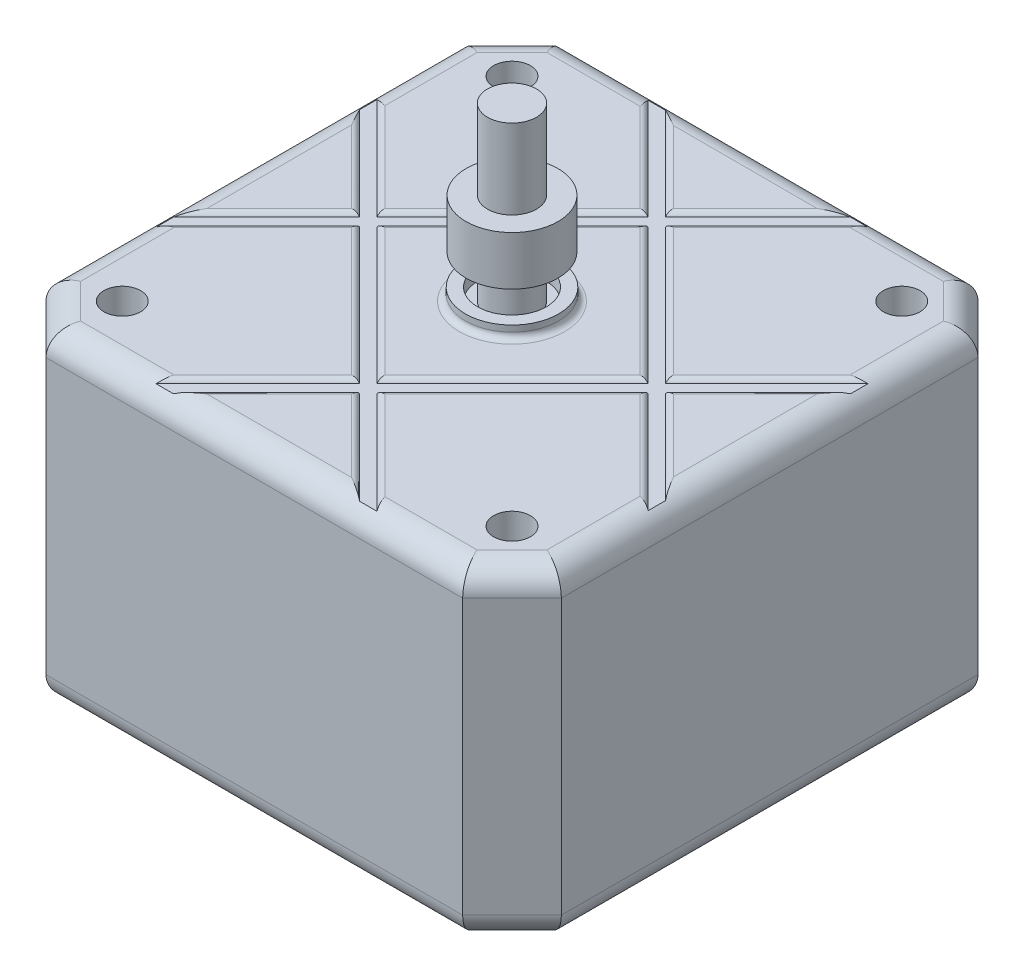
from build123d import *

# Parameters (mm, degrees)
SKETCH1_R                = 2
BOSS_EXTRUDE1_DEPTH      = 26.4
BOSS_EXTRUDE2_DEPTH      = 1
BOSS_EXTRUDE2_DEPTH_BACK = 27.4
SKETCH2_R                = 3.8
SKETCH2_R_2              = 2.8
FILLET1_R                = 2
FILLET3_R                = 2
BOSS_EXTRUDE3_DEPTH      = 14
BOSS_EXTRUDE3_DEPTH_BACK = 28
SKETCH3_R                = 2
CUT_EXTRUDE1_DEPTH       = 0.3
FILLET4_START            = -24.886359534
FILLET4_2_DEPTH          = 49.772719068
FILLET4_START_2          = -24.853755836
FILLET4_3_DEPTH          = 49.707511672
CUT_EXTRUDE2_DEPTH       = 26.4
SKETCH7_R                = 3.75
BOSS_EXTRUDE4_DEPTH      = 4


with BuildPart() as part:
    # Sketch1 → Boss-Extrude1 (new body)
    with BuildSketch(Plane(origin=(0, 0, 0), x_dir=(1, 0, 0), z_dir=(0, 1, 0))):
        Polygon((-16.976945704, 21), (17.023054296, 21), (21, 17.023054296), (21, -16.976945704), (16.976945704, -21), (-17.023054296, -21), (-21, -17.023054296), (-21, 16.976945704), align=None)
        with Locations(Location((0, 0, 0), (0, 0, 270))):
            Circle(SKETCH1_R, mode=Mode.SUBTRACT)
    extrude(amount=BOSS_EXTRUDE1_DEPTH)

    # Sketch2 → Boss-Extrude2 (add, two sides: drawn at the far end of the back side and taken through both)
    with BuildSketch(Plane(origin=(0, 26.4, 0), x_dir=(1, 0, 0), z_dir=(0, 1, 0)).offset(-BOSS_EXTRUDE2_DEPTH_BACK)):
        with Locations(Location((0, 0, 0), (0, 0, 270))):
            Circle(SKETCH2_R)
        with Locations(Location((0, 0, 0), (0, 0, 270))):
            Circle(SKETCH2_R_2, mode=Mode.SUBTRACT)
    extrude(amount=BOSS_EXTRUDE2_DEPTH + BOSS_EXTRUDE2_DEPTH_BACK)

    # Fillet1
    fillet1_edges = [part.edges().sort_by_distance(p)[0] for p in [
        (-0.023054296, 0, 21),
        (-19.011527148, 0, 19.011527148),
        (-21, 0, 0.023054296),
        (-18.988472852, 0, -18.988472852),
        (0.023054296, 0, -21),
        (19.011527148, 0, -19.011527148),
        (21, 0, -0.023054296),
        (18.988472852, 0, 18.988472852),
    ]]
    fillet(fillet1_edges, radius=FILLET1_R)

    # Fillet3
    fillet3_edges = [part.edges().sort_by_distance(p)[0] for p in [
        (-19.011527148, 26.4, 19.011527148),
        (-0.023054296, 26.4, 21),
        (18.988472852, 26.4, 18.988472852),
        (21, 26.4, -0.023054296),
        (19.011527148, 26.4, -19.011527148),
        (0.023054296, 26.4, -21),
        (-18.988472852, 26.4, -18.988472852),
        (-21, 26.4, 0.023054296),
    ]]
    fillet(fillet3_edges, radius=FILLET3_R)

    # Sketch3 → Boss-Extrude3 (add, two sides: drawn at the far end of the back side and taken through both)
    with BuildSketch(Plane(origin=(0, 26.4, 0), x_dir=(1, 0, 0), z_dir=(0, 1, 0)).offset(-BOSS_EXTRUDE3_DEPTH_BACK)):
        with Locations(Location((0, 0, 0), (0, 0, 270))):
            Circle(SKETCH3_R)
    extrude(amount=BOSS_EXTRUDE3_DEPTH + BOSS_EXTRUDE3_DEPTH_BACK)

    # Sketch5 → Cut-Extrude1 (cut)
    with BuildSketch(Plane(origin=(0, 26.4, 0), x_dir=(1, 0, 0), z_dir=(0, 1, 0))):
        Polygon((-12.453891408, 0.023054296), (-11.746784627, 0.730161077), (-19, 7.98337645), (-19, 6.569162888), align=None)
        Polygon((-19, 6.569162888), (-19, 7.98337645), (-19.583168494, 8.566544944), (-21, 9.98337645), (-21, 8.569162888), align=None)
        Polygon((-6.476945704, 19), (-8.476945704, 21), (-9.891159266, 21), (-8.479553991, 19.588394725), (-7.891159266, 19), align=None)
        Polygon((0.023054296, 12.5), (-6.476945704, 19), (-7.891159266, 19), (-0.684052485, 11.792893219), align=None)
        Polygon((7.937267858, 19), (6.523054296, 19), (0.023054296, 12.5), (0.730161077, 11.792893219), align=None)
        Polygon((9.937267858, 21), (8.523054296, 21), (6.523054296, 19), (7.937267858, 19), (8.523054296, 19.585786438), align=None)
        Polygon((0.730161077, 11.792893219), (0.023054296, 12.5), (-0.684052485, 11.792893219), (0.023054296, 11.085786438), align=None)
        Polygon((0.023054296, 11.085786438), (-0.684052485, 11.792893219), (-11.746784627, 0.730161077), (-11.039677846, 0.023054296), align=None)
        Polygon((11.792893219, 0.730161077), (0.730161077, 11.792893219), (0.023054296, 11.085786438), (11.085786438, 0.023054296), align=None)
        Polygon((19.585786438, 8.523054296), (19, 7.937267858), (19, 6.523054296), (21, 8.523054296), (21, 9.937267858), align=None)
        Polygon((19, 7.937267858), (11.792893219, 0.730161077), (12.5, 0.023054296), (19, 6.523054296), align=None)
        Polygon((12.5, 0.023054296), (11.792893219, 0.730161077), (11.085786438, 0.023054296), (11.792893219, -0.684052485), align=None)
        Polygon((19, -6.476945704), (12.5, 0.023054296), (11.792893219, -0.684052485), (19, -7.891159266), align=None)
        Polygon((11.792893219, -0.684052485), (11.085786438, 0.023054296), (0.023054296, -11.039677846), (0.730161077, -11.746784627), align=None)
        Polygon((21, -8.476945704), (19, -6.476945704), (19, -7.891159266), (19.585786438, -8.476945704), (21, -9.891159266), align=None)
        Polygon((7.98337645, -19), (0.730161077, -11.746784627), (0.023054296, -12.453891408), (6.569162888, -19), align=None)
        Polygon((8.523054296, -19.539677846), (7.98337645, -19), (6.569162888, -19), (8.523054296, -20.953891408), (8.569162888, -21), (9.98337645, -21), align=None)
        Polygon((0.023054296, -12.453891408), (-0.684052485, -11.746784627), (-7.937267858, -19), (-6.523054296, -19), align=None)
        Polygon((0.730161077, -11.746784627), (0.023054296, -11.039677846), (-0.684052485, -11.746784627), (0.023054296, -12.453891408), align=None)
        Polygon((0.023054296, -11.039677846), (-11.039677846, 0.023054296), (-11.746784627, -0.684052485), (-0.684052485, -11.746784627), align=None)
        Polygon((-6.523054296, -19), (-7.937267858, -19), (-8.523054296, -19.585786438), (-9.937267858, -21), (-8.523054296, -21), align=None)
        Polygon((-19, -7.937267858), (-19, -6.523054296), (-21, -8.523054296), (-21, -9.937267858), (-19.585786438, -8.523054296), align=None)
        Polygon((-11.746784627, -0.684052485), (-12.453891408, 0.023054296), (-19, -6.523054296), (-19, -7.937267858), align=None)
        Polygon((-11.039677846, 0.023054296), (-11.746784627, 0.730161077), (-12.453891408, 0.023054296), (-11.746784627, -0.684052485), align=None)
    extrude(amount=-CUT_EXTRUDE1_DEPTH, mode=Mode.SUBTRACT)

    # Fillet4: read off the stored shape, not the designer's step
    # Fillet4 outline → Fillet4 (revolve)
    with BuildSketch(Plane.XY):
        with BuildLine():
            ThreePointArc((4.3, 26.4), (3.946446609, 26.546446609), (3.8, 26.9))
            Line((3.8, 26.9), (3.8, 26.4))
            Line((3.8, 26.4), (4.3, 26.4))
        make_face()
    revolve(axis=Axis((0, 0, 0), (0, 1, 0)))

    # Fillet4 2 outline → Fillet4 2 (cut)
    with BuildSketch(Plane(origin=(0, 0, 0), x_dir=(0.7071067811865471, 0, 0.707106781186548), z_dir=(0.707106781186548, 0, -0.707106781186547)).offset(FILLET4_START)):
        with BuildLine():
            Line((8.822532916, -26.4), (9.280790485, -26.4))
            ThreePointArc((9.280790485, -26.4), (9.006929207, -26.318330013), (8.822532916, -26.1))
            Line((8.822532916, -26.1), (8.822532916, -26.4))
        make_face()
        with BuildLine():
            ThreePointArc((-8.822532916, -26.1), (-9.006929207, -26.318330013), (-9.280790485, -26.4))
            Line((-9.280790485, -26.4), (-8.822532916, -26.4))
            Line((-8.822532916, -26.4), (-8.822532916, -26.1))
        make_face()
        with BuildLine():
            ThreePointArc((7.822532916, -26.1), (7.638136625, -26.318330013), (7.364275346, -26.4))
            Line((7.364275346, -26.4), (7.822532916, -26.4))
            Line((7.822532916, -26.4), (7.822532916, -26.1))
        make_face()
        with BuildLine():
            ThreePointArc((-7.364275346, -26.4), (-7.638136625, -26.318330013), (-7.822532916, -26.1))
            Line((-7.822532916, -26.1), (-7.822532916, -26.4))
            Line((-7.822532916, -26.4), (-7.364275346, -26.4))
        make_face()
    extrude(amount=FILLET4_2_DEPTH, mode=Mode.SUBTRACT)

    # Fillet4 3 outline → Fillet4 3 (cut)
    with BuildSketch(Plane(origin=(0, 0, 0), x_dir=(0.7071067811865471, 0, -0.707106781186548), z_dir=(0.707106781186548, 0, 0.707106781186547)).offset(FILLET4_START_2)):
        with BuildLine():
            Line((8.855136614, 26.4), (8.855136614, 26.1))
            ThreePointArc((8.855136614, 26.1), (9.039532905, 26.318330013), (9.313394183, 26.4))
            Line((9.313394183, 26.4), (8.855136614, 26.4))
        make_face()
        with BuildLine():
            ThreePointArc((-9.248186787, 26.4), (-8.974325509, 26.318330013), (-8.789929218, 26.1))
            Line((-8.789929218, 26.1), (-8.789929218, 26.4))
            Line((-8.789929218, 26.4), (-9.248186787, 26.4))
        make_face()
        with BuildLine():
            Line((7.855136614, 26.4), (7.396879044, 26.4))
            ThreePointArc((7.396879044, 26.4), (7.670740323, 26.318330013), (7.855136614, 26.1))
            Line((7.855136614, 26.1), (7.855136614, 26.4))
        make_face()
        with BuildLine():
            ThreePointArc((-7.789929218, 26.1), (-7.605532927, 26.318330013), (-7.331671648, 26.4))
            Line((-7.331671648, 26.4), (-7.789929218, 26.4))
            Line((-7.789929218, 26.4), (-7.789929218, 26.1))
        make_face()
    extrude(amount=FILLET4_3_DEPTH, mode=Mode.SUBTRACT)

    # Sketch6 → Cut-Extrude2 (cut)
    with BuildSketch(Plane.XZ):
        with BuildLine():
            Line((-15.9, 14.4), (-15.9, 15.9))
            Line((-15.9, 15.9), (-14.4, 15.9))
            ThreePointArc((-14.4, 15.9), (-16.960660172, 16.960660172), (-15.9, 14.4))
        make_face()
        with BuildLine():
            Line((-14.4, 15.9), (-15.9, 15.9))
            Line((-15.9, 15.9), (-15.9, 14.4))
            ThreePointArc((-15.9, 14.4), (-14.839339828, 14.839339828), (-14.4, 15.9))
        make_face()
        with BuildLine():
            ThreePointArc((17.4, 15.9), (15.9, 17.4), (14.4, 15.9))
            Line((14.4, 15.9), (15.9, 15.9))
            Line((15.9, 15.9), (15.9, 14.4))
            ThreePointArc((15.9, 14.4), (16.960660172, 14.839339828), (17.4, 15.9))
        make_face()
        with BuildLine():
            Line((15.9, 15.9), (14.4, 15.9))
            ThreePointArc((14.4, 15.9), (14.839339828, 14.839339828), (15.9, 14.4))
            Line((15.9, 14.4), (15.9, 15.9))
        make_face()
        with BuildLine():
            ThreePointArc((17.4, -15.9), (16.960660172, -14.839339828), (15.9, -14.4))
            Line((15.9, -14.4), (15.9, -15.9))
            Line((15.9, -15.9), (14.4, -15.9))
            ThreePointArc((14.4, -15.9), (15.9, -17.4), (17.4, -15.9))
        make_face()
        with BuildLine():
            Line((15.9, -15.9), (15.9, -14.4))
            ThreePointArc((15.9, -14.4), (14.839339828, -14.839339828), (14.4, -15.9))
            Line((14.4, -15.9), (15.9, -15.9))
        make_face()
        with BuildLine():
            ThreePointArc((-14.4, -15.9), (-14.839339828, -14.839339828), (-15.9, -14.4))
            Line((-15.9, -14.4), (-15.9, -15.9))
            Line((-15.9, -15.9), (-14.4, -15.9))
        make_face()
        with BuildLine():
            Line((-15.9, -15.9), (-15.9, -14.4))
            ThreePointArc((-15.9, -14.4), (-16.960660172, -16.960660172), (-14.4, -15.9))
            Line((-14.4, -15.9), (-15.9, -15.9))
        make_face()
    extrude(amount=-CUT_EXTRUDE2_DEPTH, mode=Mode.SUBTRACT)

    # Sketch7 → Boss-Extrude4 (add)
    with BuildSketch(Plane(origin=(0, 33.9, 0), x_dir=(1, 0, 0), z_dir=(0, 1, 0))):
        with Locations(Location((0, 0, 0), (0, 0, 270))):
            Circle(SKETCH7_R)
    extrude(amount=-BOSS_EXTRUDE4_DEPTH)


solid = part.part
